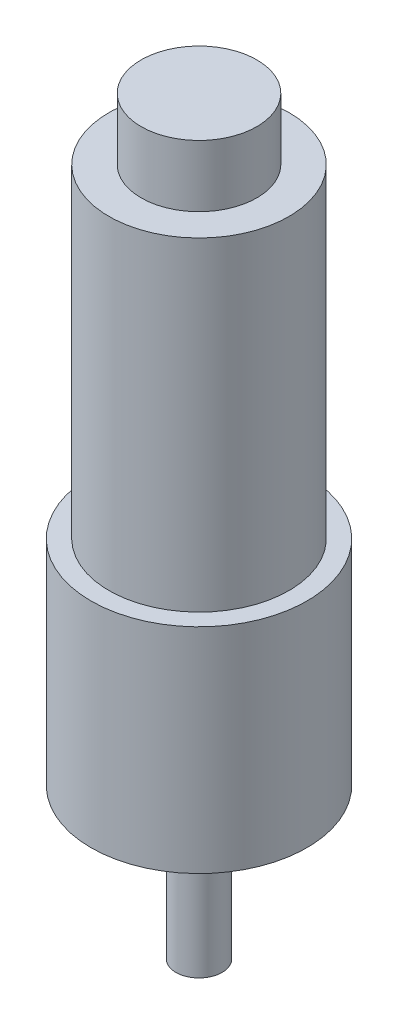
from build123d import *

# Parameters (mm, degrees)
SKETCH_1_R          = 14
EXTRUDE_1_DEPTH     = 27.7
SKETCH_3_R          = 11.669632126
EXTRUDE_2_DEPTH     = 42
SKETCH_8_R          = 7.5
EXTRUDE_4_DEPTH     = 8
SKETCH_9_R          = 8
EXTRUDE_5_DEPTH     = 1
SKETCH_5_R          = 3
EXTRUDE_3_DEPTH     = 18.5
CUT_EXTRUDE_START   = -12
CUT_EXTRUDE_2_DEPTH = 12
SKETCH_4_R          = 1.5
CUT_EXTRUDE_1_DEPTH = 4


with BuildPart() as part:
    # 草图1 → 凸台-拉伸1 (new body)
    with BuildSketch(Plane(origin=(0, 0, 0), x_dir=(1, 0, 0), z_dir=(0, 1, 0))):
        Circle(SKETCH_1_R)
    extrude(amount=EXTRUDE_1_DEPTH)

    # 草图3 → 凸台-拉伸2 (add)
    with BuildSketch(Plane(origin=(0, 27.7, 0), x_dir=(1, 0, 0), z_dir=(0, 1, 0))):
        Circle(SKETCH_3_R)
    extrude(amount=EXTRUDE_2_DEPTH)

    # 草图8 → 凸台-拉伸4 (add)
    with BuildSketch(Plane(origin=(0, 69.7, 0), x_dir=(1, 0, 0), z_dir=(0, 1, 0))):
        Circle(SKETCH_8_R)
    extrude(amount=EXTRUDE_4_DEPTH)

    # 草图9 → 凸台-拉伸5 (add)
    with BuildSketch(Plane.XZ):
        Circle(SKETCH_9_R)
    extrude(amount=EXTRUDE_5_DEPTH)

    # 草图5 → 凸台-拉伸3 (add)
    with BuildSketch(Plane.XZ.offset(1)):
        Circle(SKETCH_5_R)
    extrude(amount=EXTRUDE_3_DEPTH)

    # 草图7 → 切除-拉伸2 (cut)
    with BuildSketch(Plane.XZ.offset(19.5).offset(CUT_EXTRUDE_START)):
        with BuildLine():
            Line((-1.658312395, -2.5), (1.658312395, -2.5))
            ThreePointArc((1.658312395, -2.5), (0, -3), (-1.658312395, -2.5))
        make_face()
    extrude(amount=CUT_EXTRUDE_2_DEPTH, mode=Mode.SUBTRACT)

    # 草图4 → 切除-拉伸1 (cut)
    with BuildSketch(Plane.XZ):
        with Locations((0, 11)):
            Circle(SKETCH_4_R)
        with Locations((11, 0)):
            Circle(SKETCH_4_R)
        with Locations((0, -11)):
            Circle(SKETCH_4_R)
        with Locations((-11, 0)):
            Circle(SKETCH_4_R)
    extrude(amount=-CUT_EXTRUDE_1_DEPTH, mode=Mode.SUBTRACT)


solid = part.part
